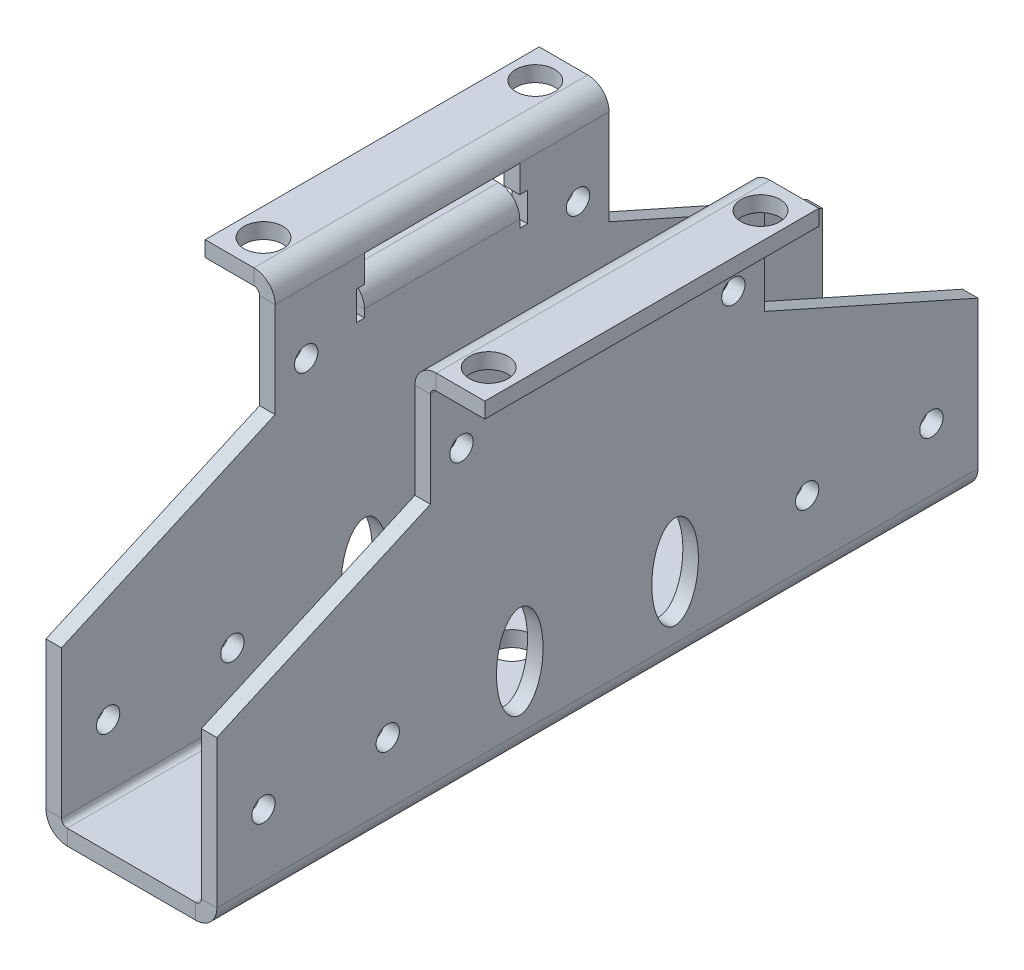
from build123d import *

# Parameters (mm, degrees)
SCHIZZO1_W                       = 18
SCHIZZO1_H                       = 98
BASE_FLANGIA1_DEPTH              = 2
BORDO_FLANGIA1_STRIP_W           = 9.4732
BORDO_FLANGIA1_STRIP_H           = 2
BORDO_FLANGIA1_STRIP_CUT_DEPTH   = 98
BORDO_FLANGIA1_STRIP_2_W         = 9.4732
BORDO_FLANGIA1_STRIP_2_H         = 2
BORDO_FLANGIA1_STRIP_CUT_2_DEPTH = 98
BORDO_FLANGIA1_DEPTH             = 98
BORDO_FLANGIA1_BEND_DEPTH        = 98
TAGLIO_ESTRUSIONE2_DEPTH         = 111.891839195
TAGLIO_ESTRUSIONE2_DEPTH_BACK    = 111.891839195
BORDO_FLANGIA2_STRIP_W           = 9.4732
BORDO_FLANGIA2_STRIP_H           = 2
BORDO_FLANGIA2_STRIP_CUT_DEPTH   = 43
BORDO_FLANGIA2_STRIP_2_W         = 9.4732
BORDO_FLANGIA2_STRIP_2_H         = 2
BORDO_FLANGIA2_STRIP_CUT_2_DEPTH = 43
BORDO_FLANGIA2_DEPTH             = 43
BORDO_FLANGIA2_BEND_DEPTH        = 43
TAGLIO_ESTRUSIONE3_DEPTH         = 114.340195871
TAGLIO_ESTRUSIONE3_DEPTH_BACK    = 114.340195871
SCHIZZO7_R                       = 1.5
SCHIZZO8_R                       = 2.5
TAGLIO_ESTRUSIONE5_DEPTH         = 112.991071073
SCHIZZO9_R                       = 2.5
TAGLIO_ESTRUSIONE6_DEPTH         = 112.991071073
TAGLIO_ESTRUSIONE7_DEPTH         = 114.340195871
TAGLIO_ESTRUSIONE7_DEPTH_BACK    = 114.340195871
SCHIZZO10_RX                     = 6
SCHIZZO10_RY                     = 3
SCHIZZO11_W                      = 20
SCHIZZO11_H                      = 3.5
TAGLIO_ESTRUSIONE8_DEPTH         = 9
BORDO_FLANGIA4_START             = -60
BORDO_FLANGIA4_DEPTH             = 22
BORDO_FLANGIA4_2_DEPTH           = 1
BORDO_FLANGIA4_START_2           = -39
BORDO_FLANGIA4_3_DEPTH           = 1
BORDO_FLANGIA4_START_3           = -59
BORDO_FLANGIA4_4_DEPTH           = 20
SCHIZZO13_R                      = 2.5
TAGLIO_ESTRUSIONE9_DEPTH         = 9


# Read off the part's stored shape, not the designer's step: Bordo-Flangia4
# Sheet-metal steps are written as plain solids
with BuildPart() as part:
    # Schizzo1 → Base-Flangia1 (new body)
    with BuildSketch(Plane(origin=(0, 0, 0), x_dir=(1, 0, 0), z_dir=(0, 1, 0))):
        with Locations((9, 49)):
            Rectangle(SCHIZZO1_W, SCHIZZO1_H)
    extrude(amount=BASE_FLANGIA1_DEPTH)

    # Bordo-Flangia1 strip (across the edge) → Bordo-Flangia1 strip cut (cut)
    with BuildSketch(Plane(origin=(0, 2, -98), x_dir=(1, 0, 0), z_dir=(0, 0, 1))):
        with Locations((-4, -1)):
            Rectangle(BORDO_FLANGIA1_STRIP_W, BORDO_FLANGIA1_STRIP_H)
    extrude(amount=BORDO_FLANGIA1_STRIP_CUT_DEPTH, mode=Mode.SUBTRACT)

    # Bordo-Flangia1 strip 2 (across the edge) → Bordo-Flangia1 strip cut 2 (cut)
    with BuildSketch(Plane(origin=(18, 2, 0), x_dir=(-1, 0, 0), z_dir=(0, 0, -1))):
        with Locations((-4, -1)):
            Rectangle(BORDO_FLANGIA1_STRIP_2_W, BORDO_FLANGIA1_STRIP_2_H)
    extrude(amount=BORDO_FLANGIA1_STRIP_CUT_2_DEPTH, mode=Mode.SUBTRACT)

    # Bordo-Flangia1 section (across the edge) → Bordo-Flangia1 (add)
    with BuildSketch(Plane(origin=(0, 2, -98), x_dir=(1, 0, 0), z_dir=(0, 0, 1))):
        with BuildLine():
            Line((-2, 0.7366), (-2, 45))
            Line((-2, 45), (0, 45))
            Line((0, 45), (0, 0.7366))
            ThreePointArc((0, 0.7366), (0.215745145, 0.215745145), (0.7366, 0))
            Line((0.7366, 0), (0.7366, -2))
            ThreePointArc((0.7366, -2), (-1.198468417, -1.198468417), (-2, 0.7366))
        make_face()
    extrude(amount=BORDO_FLANGIA1_DEPTH)

    # Bordo-Flangia1 section 2 (across the edge) → Bordo-Flangia1 bend (add)
    with BuildSketch(Plane(origin=(18, 2, 0), x_dir=(-1, 0, 0), z_dir=(0, 0, -1))):
        with BuildLine():
            Line((-2, 0.7366), (-2, 45))
            Line((-2, 45), (0, 45))
            Line((0, 45), (0, 0.7366))
            ThreePointArc((0, 0.7366), (0.215745145, 0.215745145), (0.7366, 0))
            Line((0.7366, 0), (0.7366, -2))
            ThreePointArc((0.7366, -2), (-1.198468417, -1.198468417), (-2, 0.7366))
        make_face()
    extrude(amount=BORDO_FLANGIA1_BEND_DEPTH)

    # Schizzo4 → Taglio-Estrusione2 (cut, two sides: drawn at the far end of the back side and taken through both)
    with BuildSketch(Plane.ZY.offset(2).offset(-TAGLIO_ESTRUSIONE2_DEPTH_BACK)):
        Polygon((-98, 47), (-98, 21.7366), (-70.5, 34), (-70.5, 47), align=None)
        Polygon((-27.5, 34), (0, 21.7366), (0, 47), (-27.5, 47), align=None)
    extrude(amount=TAGLIO_ESTRUSIONE2_DEPTH + TAGLIO_ESTRUSIONE2_DEPTH_BACK, mode=Mode.SUBTRACT)

    # Bordo-Flangia2 strip (across the edge) → Bordo-Flangia2 strip cut (cut)
    with BuildSketch(Plane(origin=(20, 47, -70.5), x_dir=(0, -1, 0), z_dir=(0, 0, 1))):
        with Locations((-4, -1)):
            Rectangle(BORDO_FLANGIA2_STRIP_W, BORDO_FLANGIA2_STRIP_H)
    extrude(amount=BORDO_FLANGIA2_STRIP_CUT_DEPTH, mode=Mode.SUBTRACT)

    # Bordo-Flangia2 strip 2 (across the edge) → Bordo-Flangia2 strip cut 2 (cut)
    with BuildSketch(Plane(origin=(-2, 47, -27.5), x_dir=(0, -1, 0), z_dir=(0, 0, -1))):
        with Locations((-4, -1)):
            Rectangle(BORDO_FLANGIA2_STRIP_2_W, BORDO_FLANGIA2_STRIP_2_H)
    extrude(amount=BORDO_FLANGIA2_STRIP_CUT_2_DEPTH, mode=Mode.SUBTRACT)

    # Bordo-Flangia2 section (across the edge) → Bordo-Flangia2 (add)
    with BuildSketch(Plane(origin=(20, 47, -70.5), x_dir=(0, -1, 0), z_dir=(0, 0, 1))):
        with BuildLine():
            Line((-2, 0.7366), (-2, 7))
            Line((-2, 7), (0, 7))
            Line((0, 7), (0, 0.7366))
            ThreePointArc((0, 0.7366), (0.215745145, 0.215745145), (0.7366, 0))
            Line((0.7366, 0), (0.7366, -2))
            ThreePointArc((0.7366, -2), (-1.198468417, -1.198468417), (-2, 0.7366))
        make_face()
    extrude(amount=BORDO_FLANGIA2_DEPTH)

    # Bordo-Flangia2 section 2 (across the edge) → Bordo-Flangia2 bend (add)
    with BuildSketch(Plane(origin=(-2, 47, -27.5), x_dir=(0, -1, 0), z_dir=(0, 0, -1))):
        with BuildLine():
            Line((-2, 0.7366), (-2, 7))
            Line((-2, 7), (0, 7))
            Line((0, 7), (0, 0.7366))
            ThreePointArc((0, 0.7366), (0.215745145, 0.215745145), (0.7366, 0))
            Line((0.7366, 0), (0.7366, -2))
            ThreePointArc((0.7366, -2), (-1.198468417, -1.198468417), (-2, 0.7366))
        make_face()
    extrude(amount=BORDO_FLANGIA2_BEND_DEPTH)

    # Schizzo7 → Taglio-Estrusione3 (cut, two sides: drawn at the far end of the back side and taken through both)
    with BuildSketch(Plane.ZY.offset(2).offset(-TAGLIO_ESTRUSIONE3_DEPTH_BACK)):
        with Locations(Location((-66.5, 38.2634, 0), (0, 0, 270))):
            Circle(SCHIZZO7_R)
        with Locations(Location((-31.5, 38.2634, 0), (0, 0, 270))):
            Circle(SCHIZZO7_R)
        with Locations(Location((-92, 10.7366, 0), (0, 0, 270))):
            Circle(SCHIZZO7_R)
        with Locations(Location((-6, 10.7366, 0), (0, 0, 270))):
            Circle(SCHIZZO7_R)
        with Locations(Location((-76, 10.7366, 0), (0, 0, 270))):
            Circle(SCHIZZO7_R)
        with Locations(Location((-22, 10.7366, 0), (0, 0, 270))):
            Circle(SCHIZZO7_R)
    extrude(amount=TAGLIO_ESTRUSIONE3_DEPTH + TAGLIO_ESTRUSIONE3_DEPTH_BACK, mode=Mode.SUBTRACT)

    # Schizzo8 → Taglio-Estrusione5 (cut, through all)
    with BuildSketch(Plane.XZ.offset(-47)):
        with Locations(Location((23.5, -31.5, 0), (0, 0, 270))):
            Circle(SCHIZZO8_R)
        with Locations(Location((23.5, -66.5, 0), (0, 0, 270))):
            Circle(SCHIZZO8_R)
    extrude(amount=-TAGLIO_ESTRUSIONE5_DEPTH, mode=Mode.SUBTRACT)

    # Schizzo9 → Taglio-Estrusione6 (cut, through all)
    with BuildSketch(Plane.XZ.offset(-47)):
        with Locations(Location((-5.5, -31.5, 0), (0, 0, 270))):
            Circle(SCHIZZO9_R)
        with Locations(Location((-5.5, -66.5, 0), (0, 0, 270))):
            Circle(SCHIZZO9_R)
    extrude(amount=-TAGLIO_ESTRUSIONE6_DEPTH, mode=Mode.SUBTRACT)

    # Schizzo10 → Taglio-Estrusione7 (cut, two sides: drawn at the far end of the back side and taken through both)
    with BuildSketch(Plane.ZY.offset(2).offset(-TAGLIO_ESTRUSIONE7_DEPTH_BACK)):
        with Locations(Location((-59, 10.7366), (0, 0, -90))):
            Ellipse(SCHIZZO10_RX, SCHIZZO10_RY)
        with Locations(Location((-39, 10.7366), (0, 0, 90))):
            Ellipse(SCHIZZO10_RX, SCHIZZO10_RY)
    extrude(amount=TAGLIO_ESTRUSIONE7_DEPTH + TAGLIO_ESTRUSIONE7_DEPTH_BACK, mode=Mode.SUBTRACT)

    # Schizzo11 → Taglio-Estrusione8 (cut)
    with BuildSketch(Plane.ZY.offset(2)):
        with Locations((-49, 44.5134)):
            Rectangle(SCHIZZO11_W, SCHIZZO11_H)
    extrude(amount=-TAGLIO_ESTRUSIONE8_DEPTH, mode=Mode.SUBTRACT)

    # Bordo-Flangia4 outline → Bordo-Flangia4 (cut)
    with BuildSketch(Plane.XY.offset(BORDO_FLANGIA4_START)):
        with BuildLine():
            Line((0, 42.7634), (-2, 42.7634))
            Line((-2, 42.7634), (-2, 42.662402398))
            ThreePointArc((-2, 42.662402398), (-0.556604688, 41.681067209), (0, 40.0268))
            Line((0, 40.0268), (0, 42.7634))
        make_face()
    extrude(amount=BORDO_FLANGIA4_DEPTH, mode=Mode.SUBTRACT)

    # Bordo-Flangia4 2 outline → Bordo-Flangia4 2 (cut)
    with BuildSketch(Plane.XY.offset(BORDO_FLANGIA4_START)):
        with BuildLine():
            ThreePointArc((0, 40.0268), (-0.556604688, 41.681067209), (-2, 42.662402398))
            Line((-2, 42.662402398), (-2, 39.0268))
            Line((-2, 39.0268), (0, 39.0268))
            Line((0, 39.0268), (0, 40.0268))
        make_face()
    extrude(amount=BORDO_FLANGIA4_2_DEPTH, mode=Mode.SUBTRACT)

    # Bordo-Flangia4 3 outline → Bordo-Flangia4 3 (cut)
    with BuildSketch(Plane.XY.offset(BORDO_FLANGIA4_START_2)):
        with BuildLine():
            ThreePointArc((0, 40.0268), (-0.556604688, 41.681067209), (-2, 42.662402398))
            Line((-2, 42.662402398), (-2, 39.0268))
            Line((-2, 39.0268), (0, 39.0268))
            Line((0, 39.0268), (0, 40.0268))
        make_face()
    extrude(amount=BORDO_FLANGIA4_3_DEPTH, mode=Mode.SUBTRACT)

    # Bordo-Flangia4 4 outline → Bordo-Flangia4 4 (add)
    with BuildSketch(Plane.XY.offset(BORDO_FLANGIA4_START_3)):
        with BuildLine():
            Line((-2, 40.0268), (-2, 42.662402398))
            ThreePointArc((-2, 42.662402398), (-2.364854094, 42.738033029), (-2.7366, 42.7634))
            Line((-2.7366, 42.7634), (-8, 42.7634))
            Line((-8, 42.7634), (-8, 40.7634))
            Line((-8, 40.7634), (-2.7366, 40.7634))
            ThreePointArc((-2.7366, 40.7634), (-2.215745145, 40.547654855), (-2, 40.0268))
        make_face()
    extrude(amount=BORDO_FLANGIA4_4_DEPTH)

    # Schizzo13 → Taglio-Estrusione9 (cut)
    with BuildSketch(Plane.XZ):
        with Locations(Location((9, -49, 0), (0, 0, 270))):
            Circle(SCHIZZO13_R)
    extrude(amount=-TAGLIO_ESTRUSIONE9_DEPTH, mode=Mode.SUBTRACT)


solid = part.part
